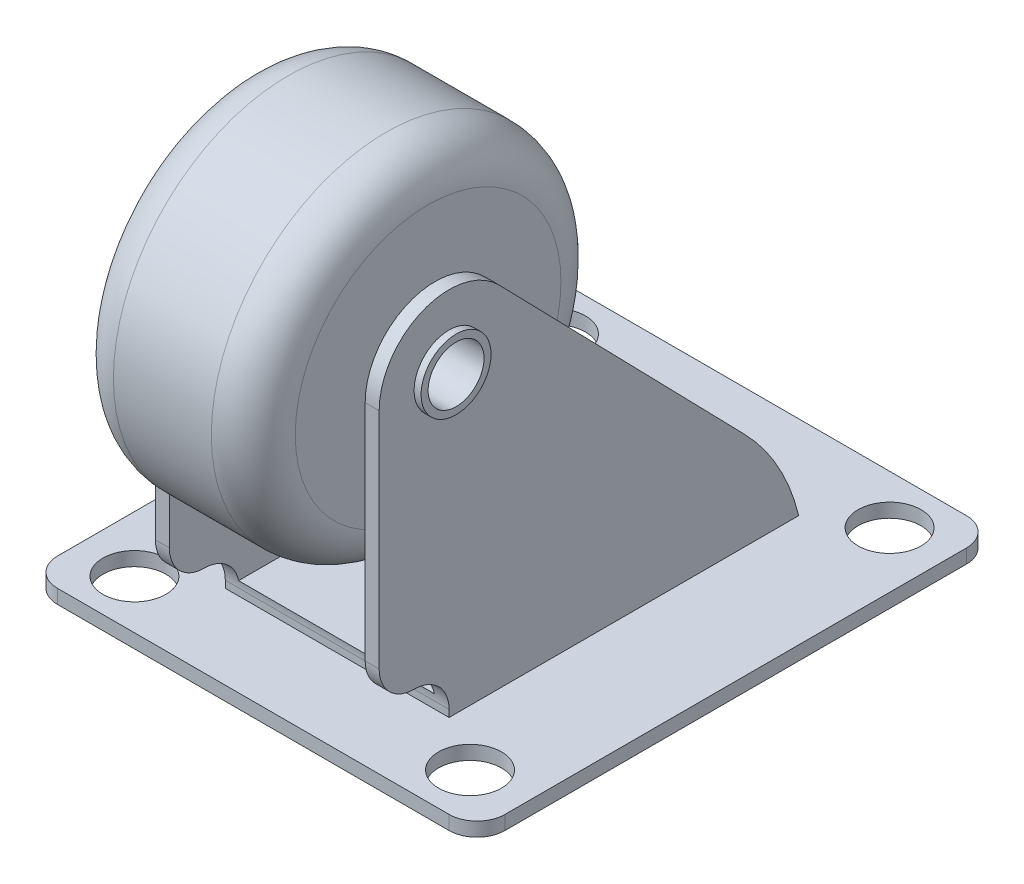
from build123d import *

# Parameters (mm, degrees)
ESBO_O1_R                = 2.25
RESSALTO_EXTRUS_O1_DEPTH = 1
ESBO_O2_R                = 2.5
RESSALTO_EXTRUS_O2_DEPTH = 8
ESBO_O3_W                = 14
ESBO_O3_H                = 25.5
CORTE_EXTRUS_O1_DEPTH    = 56.463952257
ESBO_O5_R                = 12.5
ESBO_O5_R_2              = 2.5
RESSALTO_EXTRUS_O3_DEPTH = 6.5
FILETE1_R                = 3
ESBO_O6_R                = 2.5
ESBO_O6_R_2              = 2
RESSALTO_EXTRUS_O4_DEPTH = 8.5
FILETE2_R                = 2.5
FILETE3_R                = 15


# Some blends are built 0.0001 mm under size
with BuildPart() as part:
    # Esboço1 → Ressalto-extrusão1 (new body)
    with BuildSketch(Plane(origin=(0, 0, 0), x_dir=(1, 0, 0), z_dir=(0, 1, 0))):
        with BuildLine():
            Line((2, 0), (30, 0))
            ThreePointArc((30, 0), (31.414213562, 0.585786438), (32, 2))
            Line((32, 2), (32, 35))
            ThreePointArc((32, 35), (31.414213562, 36.414213562), (30, 37))
            Line((30, 37), (2, 37))
            ThreePointArc((2, 37), (0.585786438, 36.414213562), (0, 35))
            Line((0, 35), (0, 2))
            ThreePointArc((0, 2), (0.585786438, 0.585786438), (2, 0))
        make_face()
        with Locations(Location((4, 33.5, 0), (0, 0, 270))):
            Circle(ESBO_O1_R, mode=Mode.SUBTRACT)
        with Locations(Location((28, 33.5, 0), (0, 0, 270))):
            Circle(ESBO_O1_R, mode=Mode.SUBTRACT)
        with Locations(Location((4, 3.5, 0), (0, 0, 270))):
            Circle(ESBO_O1_R, mode=Mode.SUBTRACT)
        with Locations(Location((28, 3.5, 0), (0, 0, 270))):
            Circle(ESBO_O1_R, mode=Mode.SUBTRACT)
    extrude(amount=RESSALTO_EXTRUS_O1_DEPTH)

    # Esboço2 → Ressalto-extrusão2 (add, symmetric)
    with BuildSketch(Plane(origin=(16, 0, 0), x_dir=(0, 0, -1), z_dir=(1, 0, 0))):
        with BuildLine():
            Line((1, 22.5), (1, 4))
            Line((1, 4), (6, 4))
            Line((6, 4), (6, 1))
            Line((6, 1), (31, 1))
            Line((31, 1), (31, 4))
            Line((31, 4), (9.581688719, 25.988768539))
            ThreePointArc((9.581688719, 25.988768539), (4.116976314, 27.131870227), (1, 22.5))
        make_face()
        with Locations((6, 22.5)):
            Circle(ESBO_O2_R, mode=Mode.SUBTRACT)
    extrude(amount=RESSALTO_EXTRUS_O2_DEPTH, both=True)

    # Esboço3 → Corte-extrusão1 (cut, through all)
    with BuildSketch(Plane.XY.offset(-1)):
        with Locations((16, 14.75)):
            Rectangle(ESBO_O3_W, ESBO_O3_H)
    extrude(amount=-CORTE_EXTRUS_O1_DEPTH, mode=Mode.SUBTRACT)



with BuildPart() as body_2:
    # Esboço5 → Ressalto-extrusão3 (new, symmetric)
    with BuildSketch(Plane(origin=(16, 0, 0), x_dir=(0, 0, -1), z_dir=(1, 0, 0))):
        with Locations(Location((6, 22.5, 0), (0, 0, 180))):
            Circle(ESBO_O5_R)
        with Locations(Location((6, 22.5, 0), (0, 0, 270))):
            Circle(ESBO_O5_R_2, mode=Mode.SUBTRACT)
    extrude(amount=RESSALTO_EXTRUS_O3_DEPTH, both=True)

    # Filete1
    filete1_edges = [body_2.edges().sort_by_distance(p)[0] for p in [
        (9.5, 22.5, -18.5),
        (22.5, 22.5, -18.5),
    ]]
    fillet(filete1_edges, radius=FILETE1_R)


with BuildPart() as part_1:
    add(part.part)

    add(body_2.part)  # Ressalto-extrusão4 merges body 2
    # Esboço6 → Ressalto-extrusão4 (add, symmetric)
    with BuildSketch(Plane(origin=(16, 0, 0), x_dir=(0, 0, -1), z_dir=(1, 0, 0))):
        with Locations(Location((6, 22.5, 0), (0, 0, 270))):
            Circle(ESBO_O6_R)
        with Locations((6, 22.5)):
            Circle(ESBO_O6_R_2, mode=Mode.SUBTRACT)
    extrude(amount=RESSALTO_EXTRUS_O4_DEPTH, both=True)

    # Filete2
    filete2_edges = [part_1.edges().sort_by_distance(p)[0] for p in [
        (23.5, 4, -6),
        (8.5, 4, -1),
        (23.5, 4, -1),
    ]]
    fillet(filete2_edges, radius=FILETE2_R - 0.0001)  # a hair under: the kernel refuses the full size

    # Filete3
    # the kernel refuses this fillet: 15 mm, written as the material it takes off along each edge
    with BuildSketch(Plane(origin=(37.735072013, 4, -31), x_dir=(0, -1, 0), z_dir=(-1, 0, 0))) as filete3_piece_1:
        with BuildLine():
            CenterArc((6.530725419, 14.578545127), FILETE3_R, 225.752939657, 30.632936919)
            Line((-3.935580199, 3.83347897), (0, 0))
            Line((0, 0), (3, 0))
        make_face()
    extrude(amount=28.470144026, mode=Mode.SUBTRACT)
    with BuildSketch(Plane(origin=(22.735072013, 4, -31), x_dir=(0, 0.7163377438018307, 0.6977537078403117), z_dir=(-1, 0, 0))) as filete3_piece_2:
        with BuildLine():
            CenterArc((5.494028805, -15), FILETE3_R, 90, 30.632936919)
            Line((-2.149013231, -2.093261124), (0, 0))
            Line((0, 0), (5.494028805, 0))
        make_face()
    extrude(amount=28.470144026, mode=Mode.SUBTRACT)


solid = part_1.part
